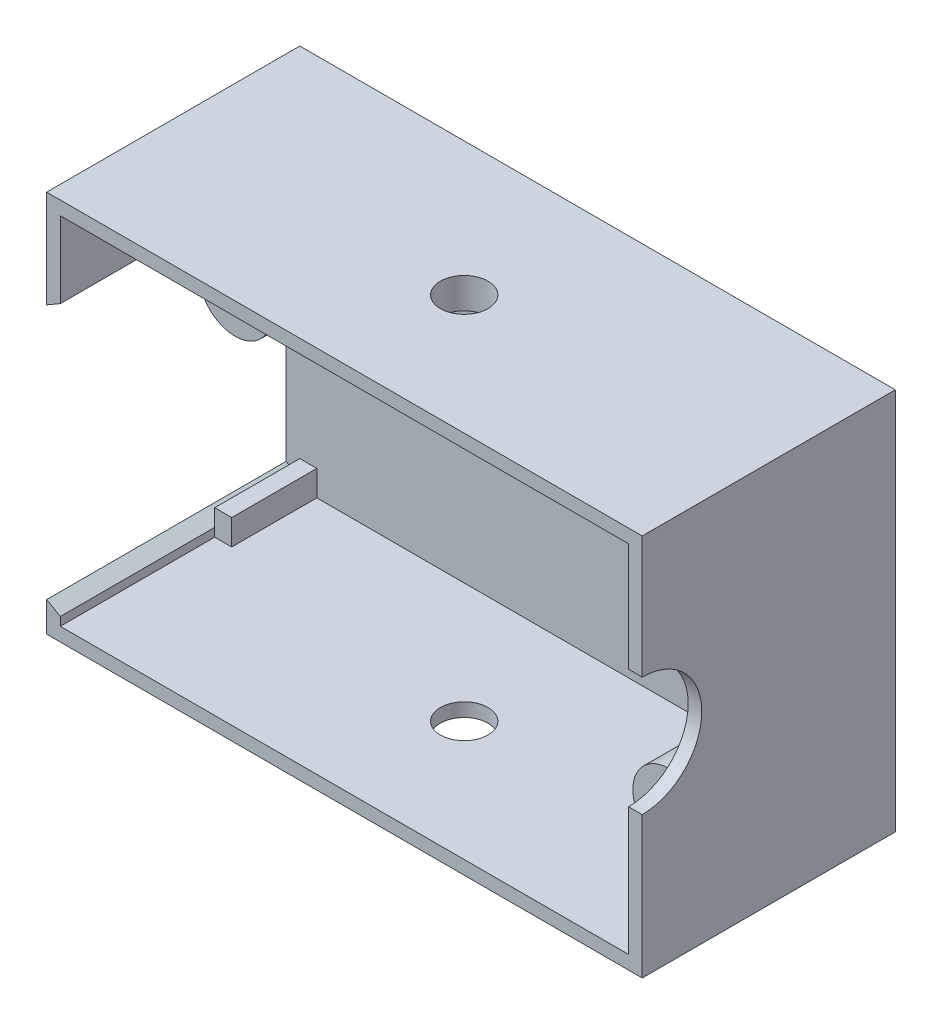
from build123d import *

# Parameters (mm, degrees)
SKETCH2_W               = 70
SKETCH2_H               = 45
BOSS_EXTRUDE1_DEPTH     = 1.6
SKETCH3_R               = 3.125
CUT_EXTRUDE1_DEPTH      = 1.6
SKETCH4_W               = 70
SKETCH4_H               = 45
SKETCH4_W_2             = 66.8
SKETCH4_H_2             = 41.8
BOSS_EXTRUDE2_DEPTH     = 28.15
BOSS_EXTRUDE3_START     = 16.5
SKETCH5_R               = 4.25
SKETCH5_R_2             = 3.125
BOSS_EXTRUDE3_DEPTH     = 16.5
BOSS_EXTRUDE4_START     = 2
SKETCH6_R               = 4.25
SKETCH6_R_2             = 1.75
BOSS_EXTRUDE4_DEPTH     = 2
CHAMFER1_SIZE           = 1.5
SKETCH7_R               = 7
CUT_EXTRUDE2_DEPTH      = 10
CUT_EXTRUDE3_DEPTH      = 28.15
CUT_EXTRUDE4_DEPTH      = 64.195114526
CUT_EXTRUDE4_DEPTH_BACK = 64.195114526
SKETCH9_R               = 2.8
SKETCH10_R              = 5
SKETCH10_R_2            = 2.8
BOSS_EXTRUDE5_DEPTH     = 2
CHAMFER2_SIZE           = 2
SKETCH11_W              = 2
SKETCH11_H              = 3
SKETCH11_H_2            = 10.952479139
BOSS_EXTRUDE6_DEPTH     = 10


# Some blends are built 0.0001 mm under size
with BuildPart() as part:
    # Sketch2 → Boss-Extrude1 (new body)
    with BuildSketch(Plane.XY):
        Rectangle(SKETCH2_W, SKETCH2_H)
    extrude(amount=BOSS_EXTRUDE1_DEPTH)

    # Sketch3 → Cut-Extrude1 (cut)
    with BuildSketch(Plane.XY.offset(1.6)):
        with Locations((-22.5, 13.5)):
            Circle(SKETCH3_R)
        with Locations((28.5, 13.5)):
            Circle(SKETCH3_R)
        with Locations((28.5, -13.5)):
            Circle(SKETCH3_R)
    extrude(amount=-CUT_EXTRUDE1_DEPTH, mode=Mode.SUBTRACT)

    # Sketch4 → Boss-Extrude2 (add)
    with BuildSketch(Plane.XY.offset(1.6)):
        Rectangle(SKETCH4_W, SKETCH4_H)
        Rectangle(SKETCH4_W_2, SKETCH4_H_2, mode=Mode.SUBTRACT)
    extrude(amount=BOSS_EXTRUDE2_DEPTH)

    # Sketch5 → Boss-Extrude3 (add)
    # profile 1 of 3: a face of its own
    with BuildSketch(Plane.XY.offset(1.6).offset(BOSS_EXTRUDE3_START)):
        with Locations((-22.5, 13.5)):
            Circle(SKETCH5_R)
        with Locations((-22.5, 13.5)):
            Circle(SKETCH5_R_2, mode=Mode.SUBTRACT)
    # profile 2 of 3: a face of its own
    with BuildSketch(Plane.XY.offset(1.6).offset(BOSS_EXTRUDE3_START)):
        with Locations((28.5, 13.5)):
            Circle(SKETCH5_R)
        with Locations((28.5, 13.5)):
            Circle(SKETCH5_R_2, mode=Mode.SUBTRACT)
    # profile 3 of 3: a face of its own
    with BuildSketch(Plane.XY.offset(1.6).offset(BOSS_EXTRUDE3_START)):
        with Locations((28.5, -13.5)):
            Circle(SKETCH5_R)
        with Locations((28.5, -13.5)):
            Circle(SKETCH5_R_2, mode=Mode.SUBTRACT)
    extrude(amount=-BOSS_EXTRUDE3_DEPTH)

    # Sketch6 → Boss-Extrude4 (add)
    # profile 1 of 3: a face of its own
    with BuildSketch(Plane.XY.offset(18.1).offset(BOSS_EXTRUDE4_START)):
        with Locations((28.5, -13.5)):
            Circle(SKETCH6_R)
        with Locations((28.5, -13.5)):
            Circle(SKETCH6_R_2, mode=Mode.SUBTRACT)
    # profile 2 of 3: a face of its own
    with BuildSketch(Plane.XY.offset(18.1).offset(BOSS_EXTRUDE4_START)):
        with Locations((28.5, 13.5)):
            Circle(SKETCH6_R)
        with Locations((28.5, 13.5)):
            Circle(SKETCH6_R_2, mode=Mode.SUBTRACT)
    # profile 3 of 3: a face of its own
    with BuildSketch(Plane.XY.offset(18.1).offset(BOSS_EXTRUDE4_START)):
        with Locations((-22.5, 13.5)):
            Circle(SKETCH6_R)
        with Locations((-22.5, 13.5)):
            Circle(SKETCH6_R_2, mode=Mode.SUBTRACT)
    extrude(amount=-BOSS_EXTRUDE4_DEPTH)

    # Chamfer1
    # the kernel refuses this chamfer: 1.5 mm, written as the material it takes off along each edge
    with BuildSketch(Plane(origin=(28.5, 13.5, 18.1), x_dir=(1, 0, 0), z_dir=(0, -1, 0))) as chamfer1_piece_1_section:
        Polygon((1.75, CHAMFER1_SIZE), (1.75 + CHAMFER1_SIZE, 0), (1.75, 0), align=None)
    chamfer1_piece_1 = revolve(axis=Axis((28.5, 13.5, 18.1), (0, 0, 1)), mode=Mode.PRIVATE)
    chamfer1_piece_1 = chamfer1_piece_1 & Plane(origin=(28.5, 13.5, 18.915495492), x_dir=(1, 0, 0), z_dir=(0, 0, 1)) * Cylinder(3.125, 13, mode=Mode.PRIVATE)
    add(chamfer1_piece_1, mode=Mode.SUBTRACT)
    with BuildSketch(Plane(origin=(28.5, -13.5, 18.1), x_dir=(1, 0, 0), z_dir=(0, -1, 0))) as chamfer1_piece_2_section:
        Polygon((1.75, CHAMFER1_SIZE), (1.75 + CHAMFER1_SIZE, 0), (1.75, 0), align=None)
    chamfer1_piece_2 = revolve(axis=Axis((28.5, -13.5, 18.1), (0, 0, 1)), mode=Mode.PRIVATE)
    chamfer1_piece_2 = chamfer1_piece_2 & Plane(origin=(28.5, -13.5, 18.915495492), x_dir=(1, 0, 0), z_dir=(0, 0, 1)) * Cylinder(3.125, 13, mode=Mode.PRIVATE)
    add(chamfer1_piece_2, mode=Mode.SUBTRACT)
    with BuildSketch(Plane(origin=(-22.5, 13.5, 18.1), x_dir=(1, 0, 0), z_dir=(0, -1, 0))) as chamfer1_piece_3_section:
        Polygon((1.75 + CHAMFER1_SIZE, 0), (1.75, CHAMFER1_SIZE), (1.75, 0), align=None)
    chamfer1_piece_3 = revolve(axis=Axis((-22.5, 13.5, 18.1), (0, 0, 1)), mode=Mode.PRIVATE)
    chamfer1_piece_3 = chamfer1_piece_3 & Plane(origin=(-22.5, 13.5, 18.915495492), x_dir=(1, 0, 0), z_dir=(0, 0, 1)) * Cylinder(3.125, 13, mode=Mode.PRIVATE)
    add(chamfer1_piece_3, mode=Mode.SUBTRACT)

    # Sketch7 → Cut-Extrude2 (cut)
    with BuildSketch(Plane(origin=(35, 0, 0), x_dir=(0, 0, -1), z_dir=(1, 0, 0))):
        with Locations((-29.75, 1.13)):
            Circle(SKETCH7_R)
    extrude(amount=-CUT_EXTRUDE2_DEPTH, mode=Mode.SUBTRACT)

    # Sketch8 → Cut-Extrude3 (cut)
    with BuildSketch(Plane.XY.offset(29.75)):
        Polygon((-35, -18.976239569), (-33.4, -19.9), (-33.4, 11.947520861), (-35, 11.023760431), align=None)
    extrude(amount=-CUT_EXTRUDE3_DEPTH, mode=Mode.SUBTRACT)

    # Sketch9 → Cut-Extrude4 (cut, two sides: drawn at the far end of the back side and taken through both)
    with BuildSketch(Plane.XZ.offset(-20.9).offset(-CUT_EXTRUDE4_DEPTH_BACK)):
        with Locations(Location((0, 15.675, 0), (0, 0, 270))):
            Circle(SKETCH9_R)
    extrude(amount=CUT_EXTRUDE4_DEPTH + CUT_EXTRUDE4_DEPTH_BACK, mode=Mode.SUBTRACT)

    # Sketch10 → Boss-Extrude5 (add)
    with BuildSketch(Plane.XZ.offset(-20.9)):
        with Locations(Location((0, 15.675, 0), (0, 0, 270))):
            Circle(SKETCH10_R)
        with Locations(Location((0, 15.675, 0), (0, 0, 270))):
            Circle(SKETCH10_R_2, mode=Mode.SUBTRACT)
    extrude(amount=BOSS_EXTRUDE5_DEPTH)

    # Chamfer2
    chamfer2_edges = [part.edges().sort_by_distance(p)[0] for p in [
        (0, 20.9, 20.675),
    ]]
    chamfer(chamfer2_edges, length=CHAMFER2_SIZE - 0.0001)  # a hair under: the kernel refuses the full size

    # Sketch11 → Boss-Extrude6 (add)
    with BuildSketch(Plane.XY.offset(1.6)):
        with Locations((-32.4, -19.4)):
            Rectangle(SKETCH11_W, SKETCH11_H)
        with Locations((-32.4, 15.423760431)):
            Rectangle(SKETCH11_W, SKETCH11_H_2)
    extrude(amount=BOSS_EXTRUDE6_DEPTH)


solid = part.part
